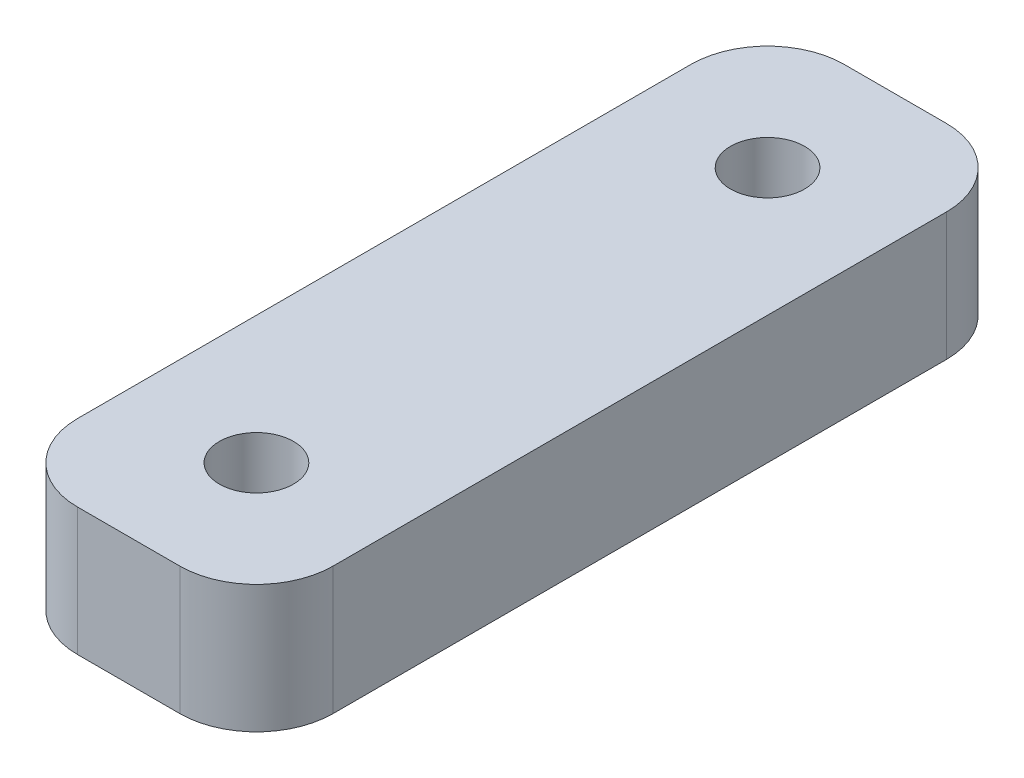
from build123d import *

# Parameters (mm, degrees)
SKETCH1_W           = 10
SKETCH1_H           = 30
SKETCH1_R           = 1.45
BOSS_EXTRUDE1_DEPTH = 5
FILLET1_R           = 3


with BuildPart() as part:
    # Sketch1 → Boss-Extrude1 (new body)
    with BuildSketch(Plane(origin=(0, 0, 0), x_dir=(1, 0, 0), z_dir=(0, 1, 0))):
        with Locations((8, 15)):
            Rectangle(SKETCH1_W, SKETCH1_H)
        with Locations((8, 25)):
            Circle(SKETCH1_R, mode=Mode.SUBTRACT)
        with Locations((8, 5)):
            Circle(SKETCH1_R, mode=Mode.SUBTRACT)
    extrude(amount=BOSS_EXTRUDE1_DEPTH)

    # Fillet1
    fillet1_edges = [part.edges().sort_by_distance(p)[0] for p in [
        (13, 2.5, -30),
        (3, 2.5, -30),
        (13, 2.5, 0),
        (3, 2.5, 0),
    ]]
    fillet(fillet1_edges, radius=FILLET1_R)


solid = part.part
